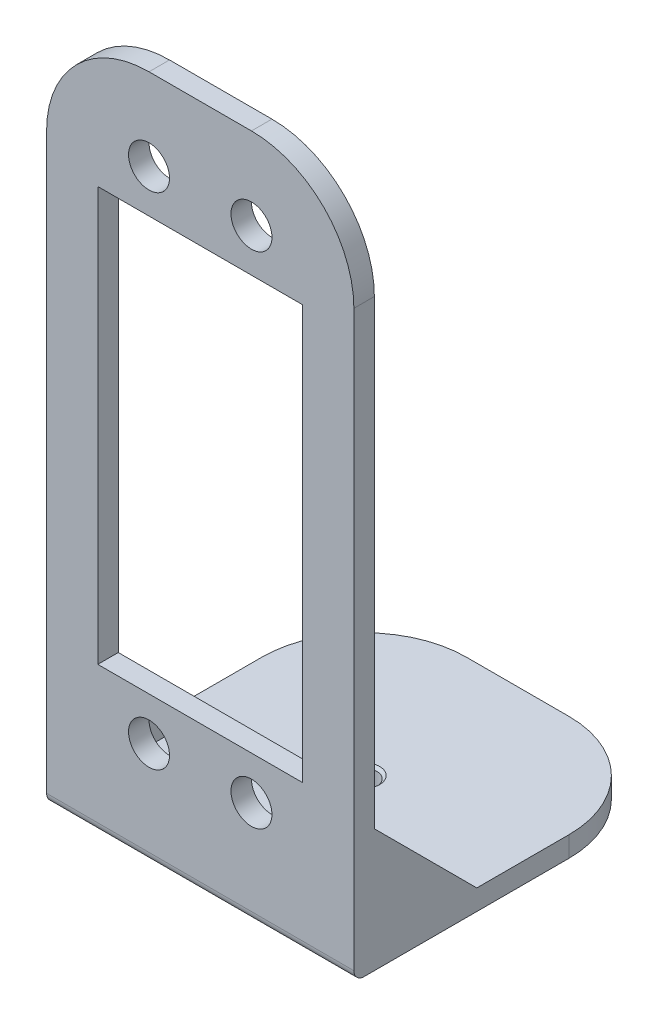
from build123d import *

# Parameters (mm, degrees)
SKETCH1_W                   = 30
SKETCH1_H                   = 30
BOSS_EXTRUDE1_DEPTH         = 2
BOSS_EXTRUDE2_DEPTH         = 65
BOSS_EXTRUDE2_DEPTH_BACK    = 2
SKETCH2_W                   = 30
SKETCH2_H                   = 2
FILLET1_R                   = 1
M3_TAPPED_HOLE1_D           = 2.5
M3_TAPPED_HOLE1_CSINK_D     = 3.05
M3_TAPPED_HOLE1_CSINK_ANGLE = 90
SKETCH11_R                  = 2
SKETCH11_W                  = 20
SKETCH11_H                  = 40.4
CUT_EXTRUDE5_DEPTH          = 2
FILLET2_R                   = 10
BOSS_EXTRUDE3_START         = -2
BOSS_EXTRUDE3_DEPTH         = 2


with BuildPart() as part:
    # Sketch1 → Boss-Extrude1 (new body)
    with BuildSketch(Plane(origin=(0, 0, 0), x_dir=(1, 0, 0), z_dir=(0, 1, 0))):
        with Locations((15, 15)):
            Rectangle(SKETCH1_W, SKETCH1_H)
    extrude(amount=BOSS_EXTRUDE1_DEPTH)

    # Sketch2 → Boss-Extrude2 (add, two sides: drawn at the far end of the back side and taken through both)
    with BuildSketch(Plane(origin=(0, 2, 0), x_dir=(1, 0, 0), z_dir=(0, 1, 0)).offset(-BOSS_EXTRUDE2_DEPTH_BACK)):
        with Locations((15, 0)):
            Rectangle(SKETCH2_W, SKETCH2_H)
    extrude(amount=BOSS_EXTRUDE2_DEPTH + BOSS_EXTRUDE2_DEPTH_BACK)

    # Fillet1
    fillet1_edges = [part.edges().sort_by_distance(p)[0] for p in [
        (15, 0, 1),
        (15, 2, -1),
    ]]
    fillet(fillet1_edges, radius=FILLET1_R)

    # M3 Tapped Hole1 (through all)
    with Locations(Plane(origin=(0, 2, 0), x_dir=(1, 0, 0), z_dir=(0, 1, 0))):
        with Locations((15, 15)):
            CounterSinkHole(M3_TAPPED_HOLE1_D / 2, M3_TAPPED_HOLE1_CSINK_D / 2, counter_sink_angle=M3_TAPPED_HOLE1_CSINK_ANGLE)

    # Sketch11 → Cut-Extrude5 (cut)
    with BuildSketch(Plane.XY.offset(1)):
        with Locations((10, 59)):
            Circle(SKETCH11_R)
        with Locations((20, 59)):
            Circle(SKETCH11_R)
        with Locations((15, 34.6)):
            Rectangle(SKETCH11_W, SKETCH11_H)
        with Locations((10, 10.2)):
            Circle(SKETCH11_R)
        with Locations((20, 10.2)):
            Circle(SKETCH11_R)
    extrude(amount=-CUT_EXTRUDE5_DEPTH, mode=Mode.SUBTRACT)

    # Fillet2
    fillet2_edges = [part.edges().sort_by_distance(p)[0] for p in [
        (0, 67, 0),
        (30, 67, 0),
        (30, 1, -30),
        (0, 1, -30),
    ]]
    fillet(fillet2_edges, radius=FILLET2_R)

    # Sketch12 → Boss-Extrude3 (add)
    with BuildSketch(Plane.ZY.offset(BOSS_EXTRUDE3_START)):
        with BuildLine():
            Line((-1, 3), (-1, 12))
            Line((-1, 12), (-11, 2))
            Line((-11, 2), (-2, 2))
            ThreePointArc((-2, 2), (-1.292893219, 2.292893219), (-1, 3))
        make_face()
    boss_extrude3 = extrude(amount=BOSS_EXTRUDE3_DEPTH)

    # Mirror1: Boss-Extrude3 across plane
    add(boss_extrude3.mirror(Plane(origin=(15, 0, 0), x_dir=(0, 0, 1), z_dir=(1, 0, 0))))


solid = part.part
